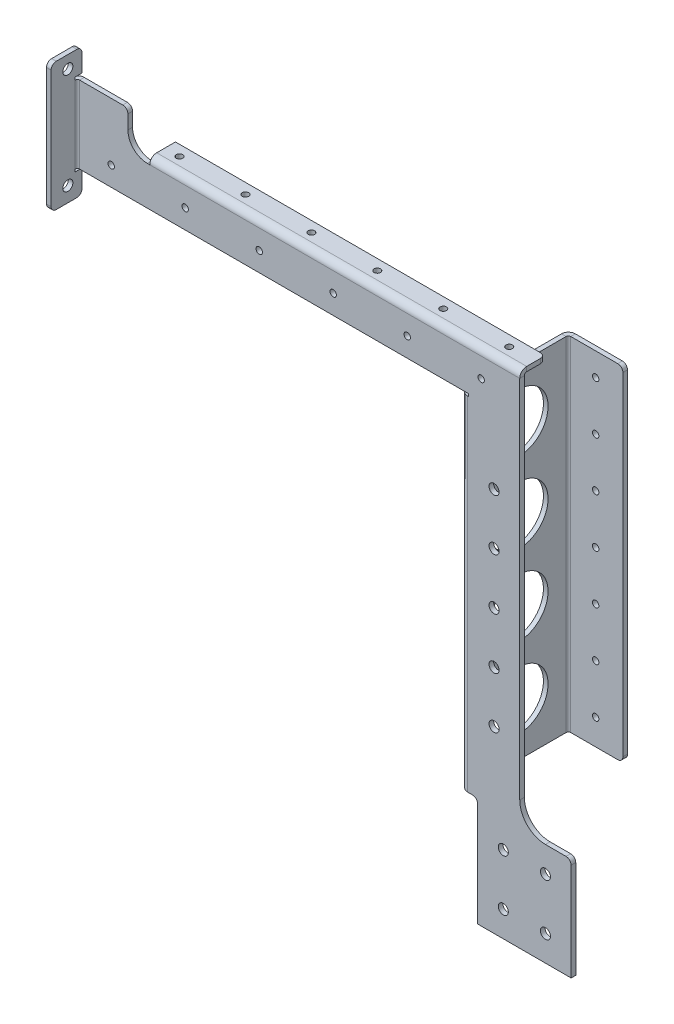
from build123d import *

# Parameters (mm, degrees)
SKETCH1_R                    = 2.4892
SKETCH1_R_2                  = 1.5875
BASE_FLANGE1_DEPTH           = 2.286
EDGE_FLANGE2_DEPTH           = 169.545
EDGE_FLANGE3_STRIP_W         = 21.43
EDGE_FLANGE3_STRIP_H         = 2.286
EDGE_FLANGE3_STRIP_CUT_DEPTH = 169.545
EDGE_FLANGE3_DEPTH           = 169.545
EDGE_FLANGE3_PROFILE_W       = 169.545
EDGE_FLANGE3_PROFILE_H       = 25.781
EDGE_FLANGE3_PROFILE_R       = 1.5875
EDGE_FLANGE3_FLAT_DEPTH      = 2.286
EDGE_FLANGE6_DEPTH           = 151.257
EDGE_FLANGE7_STRIP_W         = 21.43
EDGE_FLANGE7_STRIP_H         = 2.286
EDGE_FLANGE7_STRIP_CUT_DEPTH = 151.257
EDGE_FLANGE7_DEPTH           = 151.257
EDGE_FLANGE7_PROFILE_W       = 151.257
EDGE_FLANGE7_PROFILE_H       = 13.23975
EDGE_FLANGE7_PROFILE_R       = 1.63195
EDGE_FLANGE7_FLAT_DEPTH      = 2.286
EDGE_FLANGE8_DEPTH           = 220.98
EDGE_FLANGE8_START           = -2.286
EDGE_FLANGE8_PROFILE_W       = 220.98
EDGE_FLANGE8_PROFILE_H       = 9.271
EDGE_FLANGE8_PROFILE_R       = 1.5875
EDGE_FLANGE8_FLAT_DEPTH      = 2.286
FILLET1_R                    = 2.54
FILLET2_R                    = 12.7
SKETCH35_W                   = 16.66875
SKETCH35_H                   = 152.4
SKETCH35_W_2                 = 38.1
SKETCH35_H_2                 = 3.429
CUT_EXTRUDE1_DEPTH           = 307.869010961
BOSS_EXTRUDE1_START          = -2.286
BOSS_EXTRUDE1_DEPTH          = 2.286
EDGE_FLANGE9_STRIP_W         = 21.43
EDGE_FLANGE9_STRIP_H         = 2.286
EDGE_FLANGE9_STRIP_CUT_DEPTH = 38.1
EDGE_FLANGE9_DEPTH           = 38.1
BOSS_EXTRUDE2_DEPTH          = 2.286
F_10_CLEARANCE_HOLE1_D       = 4.9784
FILLET3_R                    = 2.54
SKETCH43_R                   = 14.2875
CUT_EXTRUDE2_DEPTH           = 2.54


# Sheet-metal steps are written as plain solids
with BuildPart() as part:
    # Sketch1 → Base-Flange1 (new body)
    with BuildSketch(Plane.XY):
        Polygon((0, 0), (0, 171.45), (220.98, 171.45), (220.98, -21.59), (246.38, -21.59), (246.38, -72.39), (200.152, -72.39), (200.152, -18.415), (195.58, -18.415), (195.58, 152.4), (7.62, 152.4), (7.62, 0), align=None)
        with Locations((233.68, -59.69)):
            Circle(SKETCH1_R, mode=Mode.SUBTRACT)
        with Locations((212.852, -59.69)):
            Circle(SKETCH1_R, mode=Mode.SUBTRACT)
        with Locations((212.852, -34.29)):
            Circle(SKETCH1_R, mode=Mode.SUBTRACT)
        with Locations((233.68, -34.29)):
            Circle(SKETCH1_R, mode=Mode.SUBTRACT)
        with Locations((208.28, 117.7925)):
            Circle(SKETCH1_R, mode=Mode.SUBTRACT)
        with Locations((208.28, 92.3925)):
            Circle(SKETCH1_R, mode=Mode.SUBTRACT)
        with Locations((208.28, 66.9925)):
            Circle(SKETCH1_R, mode=Mode.SUBTRACT)
        with Locations((208.28, 41.5925)):
            Circle(SKETCH1_R, mode=Mode.SUBTRACT)
        with Locations((208.28, 16.1925)):
            Circle(SKETCH1_R, mode=Mode.SUBTRACT)
        with Locations((19.05, 161.925)):
            Circle(SKETCH1_R_2, mode=Mode.SUBTRACT)
        with Locations((55.626, 161.925)):
            Circle(SKETCH1_R_2, mode=Mode.SUBTRACT)
        with Locations((92.202, 161.925)):
            Circle(SKETCH1_R_2, mode=Mode.SUBTRACT)
        with Locations((128.778, 161.925)):
            Circle(SKETCH1_R_2, mode=Mode.SUBTRACT)
        with Locations((165.354, 161.925)):
            Circle(SKETCH1_R_2, mode=Mode.SUBTRACT)
        with Locations((201.93, 161.925)):
            Circle(SKETCH1_R_2, mode=Mode.SUBTRACT)
    extrude(amount=-BASE_FLANGE1_DEPTH)

    # Edge-Flange2 section (across the edge) → Edge-Flange2 (add)
    with BuildSketch(Plane(origin=(194.056, -18.415, -2.286), x_dir=(1, 0, 0), z_dir=(0, 1, 0))):
        with BuildLine():
            Line((-2.286, 1.143), (-2.286, 50.9905))
            Line((-2.286, 50.9905), (0, 50.9905))
            Line((0, 50.9905), (0, 1.143))
            ThreePointArc((0, 1.143), (0.334776949, 0.334776949), (1.143, 0))
            Line((1.143, 0), (1.524, 0))
            Line((1.524, 0), (1.524, -2.286))
            Line((1.524, -2.286), (1.143, -2.286))
            ThreePointArc((1.143, -2.286), (-1.281669153, -1.281669153), (-2.286, 1.143))
        make_face()
    extrude(amount=EDGE_FLANGE2_DEPTH)

    # Edge-Flange3 strip (across the edge) → Edge-Flange3 strip cut (cut)
    with BuildSketch(Plane(origin=(194.056, -18.415, -53.2765), x_dir=(0, 0, 1), z_dir=(0, 1, 0))):
        with Locations((-7.286, -1.143)):
            Rectangle(EDGE_FLANGE3_STRIP_W, EDGE_FLANGE3_STRIP_H)
    extrude(amount=EDGE_FLANGE3_STRIP_CUT_DEPTH, mode=Mode.SUBTRACT)

    # Edge-Flange3 bend section (across the edge) → Edge-Flange3 (add)
    with BuildSketch(Plane(origin=(194.056, -18.415, -53.2765), x_dir=(0, 0, 1), z_dir=(0, 1, 0))):
        with BuildLine():
            Line((0, 1.143), (2.286, 1.143))
            ThreePointArc((2.286, 1.143), (2.620776949, 0.334776949), (3.429, 0))
            Line((3.429, 0), (3.429, -2.286))
            ThreePointArc((3.429, -2.286), (1.004330847, -1.281669153), (0, 1.143))
        make_face()
    extrude(amount=EDGE_FLANGE3_DEPTH)

    # Edge-Flange3 profile (on flange) → Edge-Flange3 flat (add)
    with BuildSketch(Plane(origin=(194.056, 0, -53.2765), x_dir=(0, 1, 0), z_dir=(0, 0, -1))):
        with Locations((66.3575, 14.0335)):
            Rectangle(EDGE_FLANGE3_PROFILE_W, EDGE_FLANGE3_PROFILE_H)
        with Locations((139.7, 13.462)):
            Circle(EDGE_FLANGE3_PROFILE_R, mode=Mode.SUBTRACT)
        with Locations((115.464166667, 13.462)):
            Circle(EDGE_FLANGE3_PROFILE_R, mode=Mode.SUBTRACT)
        with Locations((91.228333333, 13.462)):
            Circle(EDGE_FLANGE3_PROFILE_R, mode=Mode.SUBTRACT)
        with Locations((66.9925, 13.462)):
            Circle(EDGE_FLANGE3_PROFILE_R, mode=Mode.SUBTRACT)
        with Locations((42.756666667, 13.462)):
            Circle(EDGE_FLANGE3_PROFILE_R, mode=Mode.SUBTRACT)
        with Locations((18.520833333, 13.462)):
            Circle(EDGE_FLANGE3_PROFILE_R, mode=Mode.SUBTRACT)
        with Locations((-5.715, 13.462)):
            Circle(EDGE_FLANGE3_PROFILE_R, mode=Mode.SUBTRACT)
    extrude(amount=-EDGE_FLANGE3_FLAT_DEPTH)

    # Edge-Flange6 section (across the edge) → Edge-Flange6 (add)
    with BuildSketch(Plane(origin=(9.144, 151.257, -2.286), x_dir=(-1, 0, 0), z_dir=(0, -1, 0))):
        with BuildLine():
            Line((-2.286, 1.143), (-2.286, 48.514))
            Line((-2.286, 48.514), (0, 48.514))
            Line((0, 48.514), (0, 1.143))
            ThreePointArc((0, 1.143), (0.334776949, 0.334776949), (1.143, 0))
            Line((1.143, 0), (1.524, 0))
            Line((1.524, 0), (1.524, -2.286))
            Line((1.524, -2.286), (1.143, -2.286))
            ThreePointArc((1.143, -2.286), (-1.281669153, -1.281669153), (-2.286, 1.143))
        make_face()
    extrude(amount=EDGE_FLANGE6_DEPTH)

    # Edge-Flange7 strip (across the edge) → Edge-Flange7 strip cut (cut)
    with BuildSketch(Plane(origin=(9.144, 151.257, -50.8), x_dir=(0, 0, 1), z_dir=(0, -1, 0))):
        with Locations((-7.286, -1.143)):
            Rectangle(EDGE_FLANGE7_STRIP_W, EDGE_FLANGE7_STRIP_H)
    extrude(amount=EDGE_FLANGE7_STRIP_CUT_DEPTH, mode=Mode.SUBTRACT)

    # Edge-Flange7 bend section (across the edge) → Edge-Flange7 (add)
    with BuildSketch(Plane(origin=(9.144, 151.257, -50.8), x_dir=(0, 0, 1), z_dir=(0, -1, 0))):
        with BuildLine():
            Line((0, 1.143), (2.286, 1.143))
            ThreePointArc((2.286, 1.143), (2.620776949, 0.334776949), (3.429, 0))
            Line((3.429, 0), (3.429, -2.286))
            ThreePointArc((3.429, -2.286), (1.004330847, -1.281669153), (0, 1.143))
        make_face()
    extrude(amount=EDGE_FLANGE7_DEPTH)

    # Edge-Flange7 profile (on flange) → Edge-Flange7 flat (add)
    with BuildSketch(Plane(origin=(9.144, 0, -50.8), x_dir=(0, 1, 0), z_dir=(0, 0, 1))):
        with Locations((75.6285, 7.762875)):
            Rectangle(EDGE_FLANGE7_PROFILE_W, EDGE_FLANGE7_PROFILE_H)
        with Locations((126.746, 7.14375)):
            Circle(EDGE_FLANGE7_PROFILE_R, mode=Mode.SUBTRACT)
        with Locations((83.08975, 7.14375)):
            Circle(EDGE_FLANGE7_PROFILE_R, mode=Mode.SUBTRACT)
        with Locations((39.4335, 7.14375)):
            Circle(EDGE_FLANGE7_PROFILE_R, mode=Mode.SUBTRACT)
    extrude(amount=EDGE_FLANGE7_FLAT_DEPTH)

    # Edge-Flange8 bend section (across the edge) → Edge-Flange8 (add)
    with BuildSketch(Plane(origin=(0, 172.72, -2.286), x_dir=(0, -1, 0), z_dir=(1, 0, 0))):
        with BuildLine():
            Line((-2.286, 1.143), (0, 1.143))
            ThreePointArc((0, 1.143), (0.334776949, 0.334776949), (1.143, 0))
            Line((1.143, 0), (1.27, 0))
            Line((1.27, 0), (1.27, -2.286))
            Line((1.27, -2.286), (1.143, -2.286))
            ThreePointArc((1.143, -2.286), (-1.281669153, -1.281669153), (-2.286, 1.143))
        make_face()
    extrude(amount=EDGE_FLANGE8_DEPTH)

    # Edge-Flange8 profile (on flange) → Edge-Flange8 flat (add)
    with BuildSketch(Plane(origin=(0, 172.72, -2.286), x_dir=(-1, 0, 0), z_dir=(0, -1, 0)).offset(EDGE_FLANGE8_START)):
        with Locations((-110.49, 5.7785)):
            Rectangle(EDGE_FLANGE8_PROFILE_W, EDGE_FLANGE8_PROFILE_H)
        with Locations((-12.7, 5.207)):
            Circle(EDGE_FLANGE8_PROFILE_R, mode=Mode.SUBTRACT)
        with Locations((-45.296666667, 5.207)):
            Circle(EDGE_FLANGE8_PROFILE_R, mode=Mode.SUBTRACT)
        with Locations((-77.893333333, 5.207)):
            Circle(EDGE_FLANGE8_PROFILE_R, mode=Mode.SUBTRACT)
        with Locations((-110.49, 5.207)):
            Circle(EDGE_FLANGE8_PROFILE_R, mode=Mode.SUBTRACT)
        with Locations((-143.086666667, 5.207)):
            Circle(EDGE_FLANGE8_PROFILE_R, mode=Mode.SUBTRACT)
        with Locations((-175.683333333, 5.207)):
            Circle(EDGE_FLANGE8_PROFILE_R, mode=Mode.SUBTRACT)
        with Locations((-208.28, 5.207)):
            Circle(EDGE_FLANGE8_PROFILE_R, mode=Mode.SUBTRACT)
    extrude(amount=EDGE_FLANGE8_FLAT_DEPTH)

    # Fillet1
    fillet1_edges = [part.edges().sort_by_distance(p)[0] for p in [
        (220.98, -18.415, -52.1335),
        (220.98, 151.13, -52.1335),
        (246.38, -21.59, -1.143),
        (200.152, -18.415, -1.143),
        (0, 173.863, -12.7),
        (220.98, 173.863, -12.7),
    ]]
    fillet(fillet1_edges, radius=FILLET1_R)

    # Fillet2
    fillet2_edges = [part.edges().sort_by_distance(p)[0] for p in [
        (220.98, -21.59, -1.143),
    ]]
    fillet(fillet2_edges, radius=FILLET2_R)

    # Sketch35 → Cut-Extrude1 (cut, through all)
    with BuildSketch(Plane.XY):
        with Locations((3.095625, 76.2)):
            Rectangle(SKETCH35_W, SKETCH35_H)
        with Locations((19.05, 173.2915)):
            Rectangle(SKETCH35_W_2, SKETCH35_H_2)
    extrude(amount=-CUT_EXTRUDE1_DEPTH, mode=Mode.SUBTRACT)

    # Sketch36 → Boss-Extrude1 (add)
    with BuildSketch(Plane.XY.offset(BOSS_EXTRUDE1_START)):
        with BuildLine():
            Line((36.83, 171.577), (0, 171.577))
            Line((0, 171.577), (0, 190.5))
            Line((0, 190.5), (27.305, 190.5))
            Line((27.305, 190.5), (27.305, 181.102))
            ThreePointArc((27.305, 181.102), (30.094807909, 174.366807909), (36.83, 171.577))
        make_face()
    extrude(amount=BOSS_EXTRUDE1_DEPTH)

    # Edge-Flange9 strip (across the edge) → Edge-Flange9 strip cut (cut)
    with BuildSketch(Plane.XZ.offset(-190.5)):
        with Locations((-7.286, -1.143)):
            Rectangle(EDGE_FLANGE9_STRIP_W, EDGE_FLANGE9_STRIP_H)
    extrude(amount=EDGE_FLANGE9_STRIP_CUT_DEPTH, mode=Mode.SUBTRACT)

    # Edge-Flange9 section (across the edge) → Edge-Flange9 (add)
    with BuildSketch(Plane.XZ.offset(-190.5)):
        with BuildLine():
            Line((0, 1.143), (0, 12.954))
            Line((0, 12.954), (2.286, 12.954))
            Line((2.286, 12.954), (2.286, 1.143))
            ThreePointArc((2.286, 1.143), (2.620776949, 0.334776949), (3.429, 0))
            Line((3.429, 0), (3.429, -2.286))
            ThreePointArc((3.429, -2.286), (1.004330847, -1.281669153), (0, 1.143))
        make_face()
    extrude(amount=EDGE_FLANGE9_DEPTH)

    # Sketch40 → Boss-Extrude2 (add)
    with BuildSketch(Plane(origin=(2.286, 0, 0), x_dir=(0, 0, -1), z_dir=(1, 0, 0))):
        Polygon((-12.954, 190.5), (-12.954, 203.2), (2.286, 203.2), (2.286, 191.77), (-1.143, 191.77), (-1.143, 190.5), align=None)
        Polygon((-12.954, 152.4), (-12.954, 139.7), (2.286, 139.7), (2.286, 151.13), (-1.143, 151.13), (-1.143, 152.4), align=None)
    extrude(amount=-BOSS_EXTRUDE2_DEPTH)

    # #10 Clearance Hole1 (through all)
    with Locations(Plane(origin=(2.286, 0, 0), x_dir=(0, 0, -1), z_dir=(1, 0, 0))):
        with Locations((-4.66725, 196.9643), (-4.66725, 147.0914)):
            Hole(F_10_CLEARANCE_HOLE1_D / 2)

    # Fillet3
    fillet3_edges = [part.edges().sort_by_distance(p)[0] for p in [
        (27.305, 190.5, -1.143),
        (1.143, 203.2, 12.954),
        (1.143, 203.2, -2.286),
        (1.143, 139.7, -2.286),
        (1.143, 139.7, 12.954),
    ]]
    fillet(fillet3_edges, radius=FILLET3_R)

    # Sketch43 → Cut-Extrude2 (cut)
    with BuildSketch(Plane.ZY.offset(-191.77)):
        with Locations((-26.63825, 6.9215)):
            Circle(SKETCH43_R)
        with Locations((-26.63825, 46.5455)):
            Circle(SKETCH43_R)
        with Locations((-26.63825, 86.1695)):
            Circle(SKETCH43_R)
        with Locations((-26.63825, 125.7935)):
            Circle(SKETCH43_R)
    extrude(amount=-CUT_EXTRUDE2_DEPTH, mode=Mode.SUBTRACT)


solid = part.part
